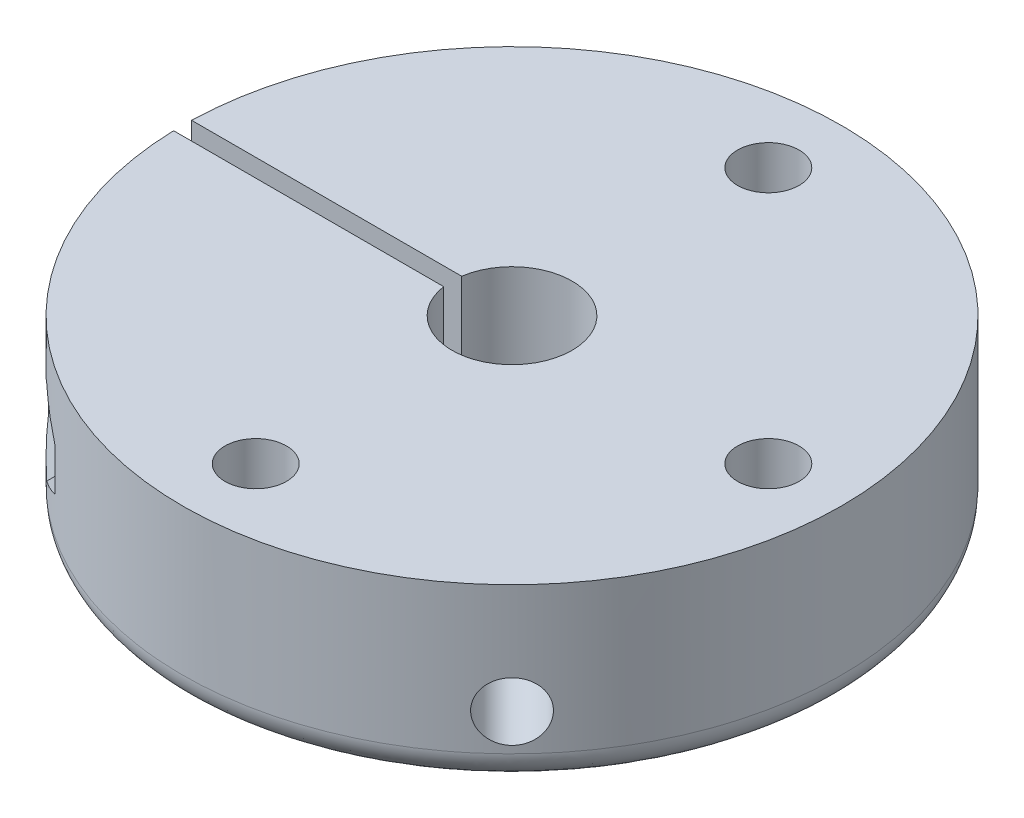
from build123d import *

# Parameters (mm, degrees)
SKETCH1_R               = 2.1
BOSS_EXTRUDE1_DEPTH     = 12
CUT_EXTRUDE1_REACH      = 57.624
SKETCH2_R               = 2
CUT_EXTRUDE2_REACH      = 42.417
CUT_EXTRUDE2_END_RADIUS = 22.5
CUT_EXTRUDE2_START      = -6
SKETCH3_R               = 3
CUT_EXTRUDE3_DEPTH      = 35.417339184
CUT_EXTRUDE3_DEPTH_BACK = 35.417339184
SKETCH3_4_R             = 1.5
CUT_EXTRUDE4_REACH      = 47.417
CUT_EXTRUDE4_START      = 11
FILLET1_R               = 2


with BuildPart() as part:
    # Sketch1 → Boss-Extrude1 (new body)
    with BuildSketch(Plane(origin=(0, 0, 0), x_dir=(1, 0, 0), z_dir=(0, 1, 0))):
        with BuildLine():
            ThreePointArc((-22.49159343, -0.615), (22.5, 0), (-22.49159343, 0.615))
            Line((-22.49159343, 0.615), (-4.053612586, 0.615))
            ThreePointArc((-4.053612586, 0.615), (4.1, 0), (-4.053612586, -0.615))
            Line((-4.053612586, -0.615), (-22.49159343, -0.615))
        make_face()
        with Locations((0, -17.5)):
            Circle(SKETCH1_R, mode=Mode.SUBTRACT)
        with Locations((17.5, 0)):
            Circle(SKETCH1_R, mode=Mode.SUBTRACT)
        with Locations((0, 17.5)):
            Circle(SKETCH1_R, mode=Mode.SUBTRACT)
    extrude(amount=BOSS_EXTRUDE1_DEPTH)

    # Sketch2 → Cut-Extrude1 (cut, up to next)
    with BuildSketch(Plane(origin=(15.909902577, 0, 15.909902577), x_dir=(0, -1, 0), z_dir=(0.7071067811865464, 0, 0.7071067811865488)), mode=Mode.PRIVATE) as cut_extrude1_sk1:
        with Locations((-4.5, 0)):
            Circle(SKETCH2_R)
    cut_extrude1_tool1 = extrude(cut_extrude1_sk1.sketch, amount=-CUT_EXTRUDE1_REACH, mode=Mode.PRIVATE) & part.part
    add(cut_extrude1_tool1.solids().sort_by_distance((15.909903, 4.5, 15.909903))[0], mode=Mode.SUBTRACT)

    # Cut-Extrude2: up to this cylinder (the profile starts inside it)
    cut_extrude2_end = Plane(origin=(0, 6, 0), z_dir=(0, -1, 0)) * Cylinder(CUT_EXTRUDE2_END_RADIUS, 130.834, mode=Mode.PRIVATE)
    # Sketch3 → Cut-Extrude2 (cut, up to the surface)
    with BuildSketch(Plane.XY.offset(-0.615).offset(CUT_EXTRUDE2_START), mode=Mode.PRIVATE) as cut_extrude2_sk1:
        with Locations((-14.99159343, 6)):
            Circle(SKETCH3_R)
    cut_extrude2_tool1 = extrude(cut_extrude2_sk1.sketch, amount=-CUT_EXTRUDE2_REACH, mode=Mode.PRIVATE) & cut_extrude2_end
    add(cut_extrude2_tool1.solids().sort_by_distance((-14.991593, 6, -6.615))[0], mode=Mode.SUBTRACT)

    # Sketch3<4> → Cut-Extrude3 (cut, two sides: drawn at the far end of the back side and taken through both)
    with BuildSketch(Plane.XY.offset(-0.615).offset(-CUT_EXTRUDE3_DEPTH_BACK)):
        with Locations((-14.99159343, 6)):
            Circle(SKETCH3_4_R)
    extrude(amount=CUT_EXTRUDE3_DEPTH + CUT_EXTRUDE3_DEPTH_BACK, mode=Mode.SUBTRACT)

    # Sketch5 → Cut-Extrude4 (cut, up to next)
    with BuildSketch(Plane.XY.offset(-0.615).offset(CUT_EXTRUDE4_START), mode=Mode.PRIVATE) as cut_extrude4_sk1:
        Polygon((-12.49159343, 7.443375673), (-14.99159343, 8.886751346), (-17.49159343, 7.443375673), (-17.49159343, 4.556624327), (-14.99159343, 3.113248654), (-12.49159343, 4.556624327), align=None)
    cut_extrude4_tool1 = extrude(cut_extrude4_sk1.sketch, amount=CUT_EXTRUDE4_REACH, mode=Mode.PRIVATE) & part.part
    add(cut_extrude4_tool1.solids().sort_by_distance((-14.991593, 6, 10.385))[0], mode=Mode.SUBTRACT)

    # Fillet1
    fillet1_edges = [part.edges().sort_by_distance(p)[0] for p in [
        (22.5, 0, 0),
    ]]
    fillet(fillet1_edges, radius=FILLET1_R)


solid = part.part
